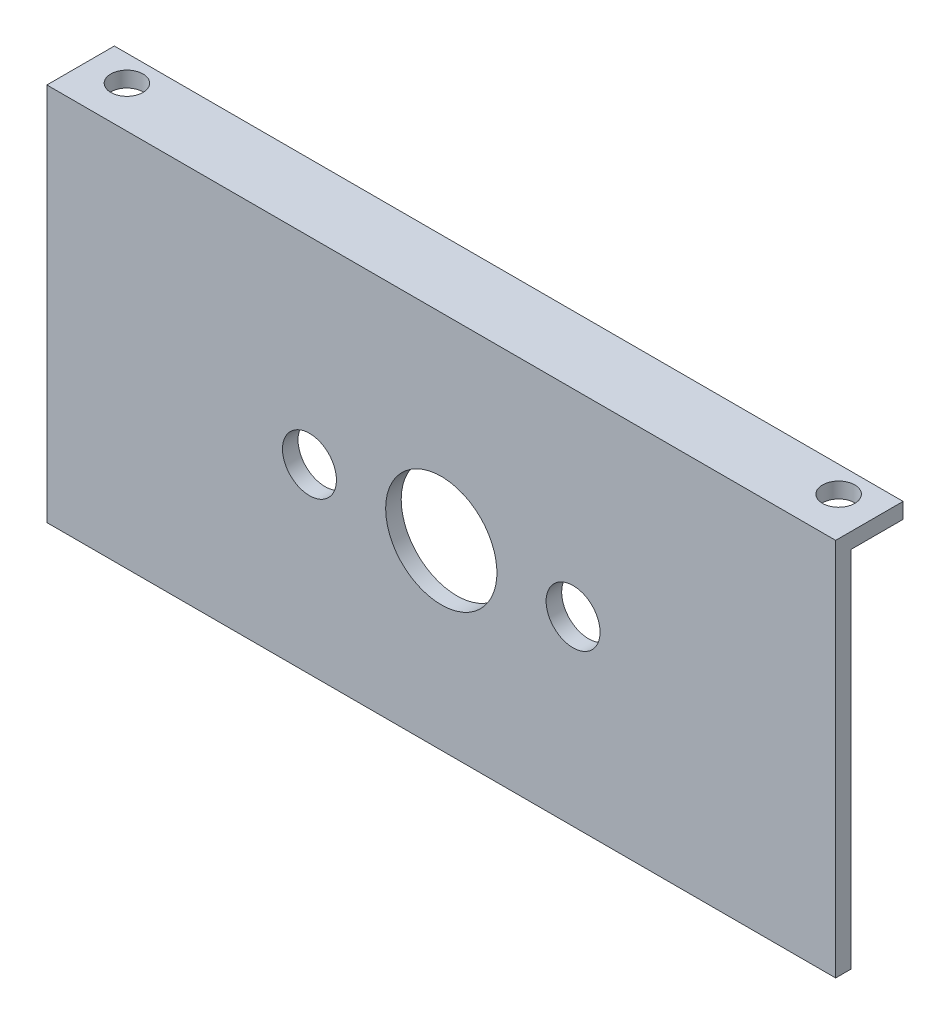
from build123d import *

# Parameters (mm, degrees)
SKETCH_1_W          = 76
SKETCH_1_H          = 5
SKETCH_1_R          = 1.55
EXTRUDE_1_DEPTH     = 1.5
SKETCH_2_W          = 76
SKETCH_2_H          = 1.5
EXTRUDE_2_DEPTH     = 1.5
SKETCH_3_W          = 76
SKETCH_3_H          = 1.5
EXTRUDE_3_DEPTH     = 35.02
SKETCH_4_R          = 5.36
SKETCH_4_R_2        = 2.6
CUT_EXTRUDE_1_DEPTH = 1.5


with BuildPart() as part:
    # 草图1 → 凸台-拉伸1 (new body)
    with BuildSketch(Plane(origin=(0, 0, 0), x_dir=(1, 0, 0), z_dir=(0, 1, 0))):
        Rectangle(SKETCH_1_W, SKETCH_1_H)
        with Locations((-34.29, 0)):
            Circle(SKETCH_1_R, mode=Mode.SUBTRACT)
        with Locations((34.29, 0)):
            Circle(SKETCH_1_R, mode=Mode.SUBTRACT)
    extrude(amount=EXTRUDE_1_DEPTH)

    # 草图2 → 凸台-拉伸2 (add)
    with BuildSketch(Plane.XY.offset(2.5)):
        with Locations((0, 0.75)):
            Rectangle(SKETCH_2_W, SKETCH_2_H)
    extrude(amount=EXTRUDE_2_DEPTH)

    # 草图3 → 凸台-拉伸3 (add)
    with BuildSketch(Plane.XZ):
        with Locations((0, 3.25)):
            Rectangle(SKETCH_3_W, SKETCH_3_H)
    extrude(amount=EXTRUDE_3_DEPTH)

    # 草图4 → 切除-拉伸1 (cut)
    with BuildSketch(Plane(origin=(0, 0, 2.5), x_dir=(-1, 0, 0), z_dir=(0, 0, -1))):
        with Locations((0, -17.52)):
            Circle(SKETCH_4_R)
        with Locations((12.7, -17.52)):
            Circle(SKETCH_4_R_2)
        with Locations((-12.7, -17.52)):
            Circle(SKETCH_4_R_2)
    extrude(amount=-CUT_EXTRUDE_1_DEPTH, mode=Mode.SUBTRACT)


solid = part.part
